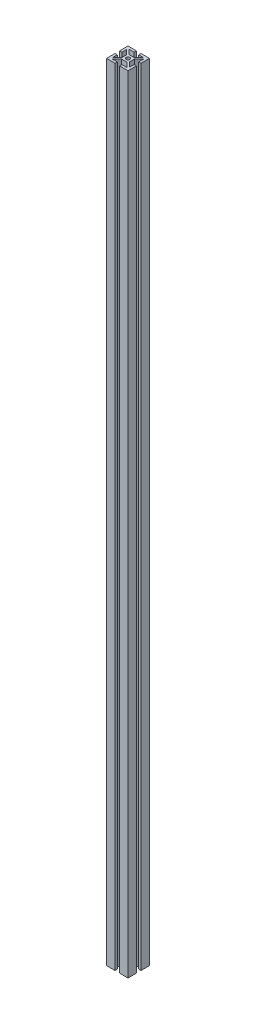
from build123d import *

# Parameters (mm, degrees)
EXTRUDE1_DEPTH     = 1397
SKETCH2_R          = 3.5687
CUT_EXTRUDE1_DEPTH = 1398.649280936


# Read off the part's stored shape, not the designer's step: 1515<1>
with BuildPart() as part:
    # Sketch1<2> → Extrude1 (new body)
    with BuildSketch(Plane(origin=(0, 0, 0), x_dir=(1, 0, 0), z_dir=(0, 1, 0))):
        Polygon((-6.7564, 4.364749804), (-6.7564, -4.364749804), (-14.986, -12.594349804), (-14.986, -4.064), (-19.05, -4.064), (-19.05, -19.05), (-4.064, -19.05), (-4.064, -14.986), (-13.067127258, -14.986), (-4.837527258, -6.7564), (4.837527258, -6.7564), (13.067127258, -14.986), (4.064, -14.986), (4.064, -19.05), (19.05, -19.05), (19.05, -4.064), (14.986, -4.064), (14.986, -12.594349804), (6.7564, -4.364749804), (6.7564, 4.364749804), (14.986, 12.594349804), (14.986, 4.064), (19.05, 4.064), (19.05, 19.05), (4.064, 19.05), (4.064, 14.986), (13.067127258, 14.986), (4.837527258, 6.7564), (-4.837527258, 6.7564), (-13.067127258, 14.986), (-4.064, 14.986), (-4.064, 19.05), (-19.05, 19.05), (-19.05, 4.064), (-14.986, 4.064), (-14.986, 12.594349804), align=None)
    extrude(amount=EXTRUDE1_DEPTH)

    # Sketch2 → Cut-Extrude1 (cut, through all)
    with BuildSketch(Plane(origin=(19.05, 0, 0), x_dir=(0, 0, -1), z_dir=(1, 0, 0))):
        with Locations((0, 1377.95)):
            Circle(SKETCH2_R)
    cut_extrude1 = extrude(amount=-CUT_EXTRUDE1_DEPTH, mode=Mode.SUBTRACT)

    # Mirror1: Cut-Extrude1 across plane
    add(cut_extrude1.mirror(Plane.ZX.offset(698.5)), mode=Mode.SUBTRACT)

    # Sketch3 → 5/16-18 Tapped Hole1 (revolve, cut)
    with BuildSketch(Plane(origin=(0, 1397, 0), x_dir=(0, 0, 1), z_dir=(1, 0, 0))):
        Polygon((0, 0), (0, 33.711148974), (3.2639, 31.75), (3.2639, 0), align=None)
    f_5_16_18_tapped_hole1 = revolve(axis=Axis((0, 1403.35, 0), (0, -1, 0)), mode=Mode.SUBTRACT)

    # Mirror2: 5/16-18 Tapped Hole1 across plane
    add(f_5_16_18_tapped_hole1.mirror(Plane.ZX.offset(698.5)), mode=Mode.SUBTRACT)


solid = part.part
